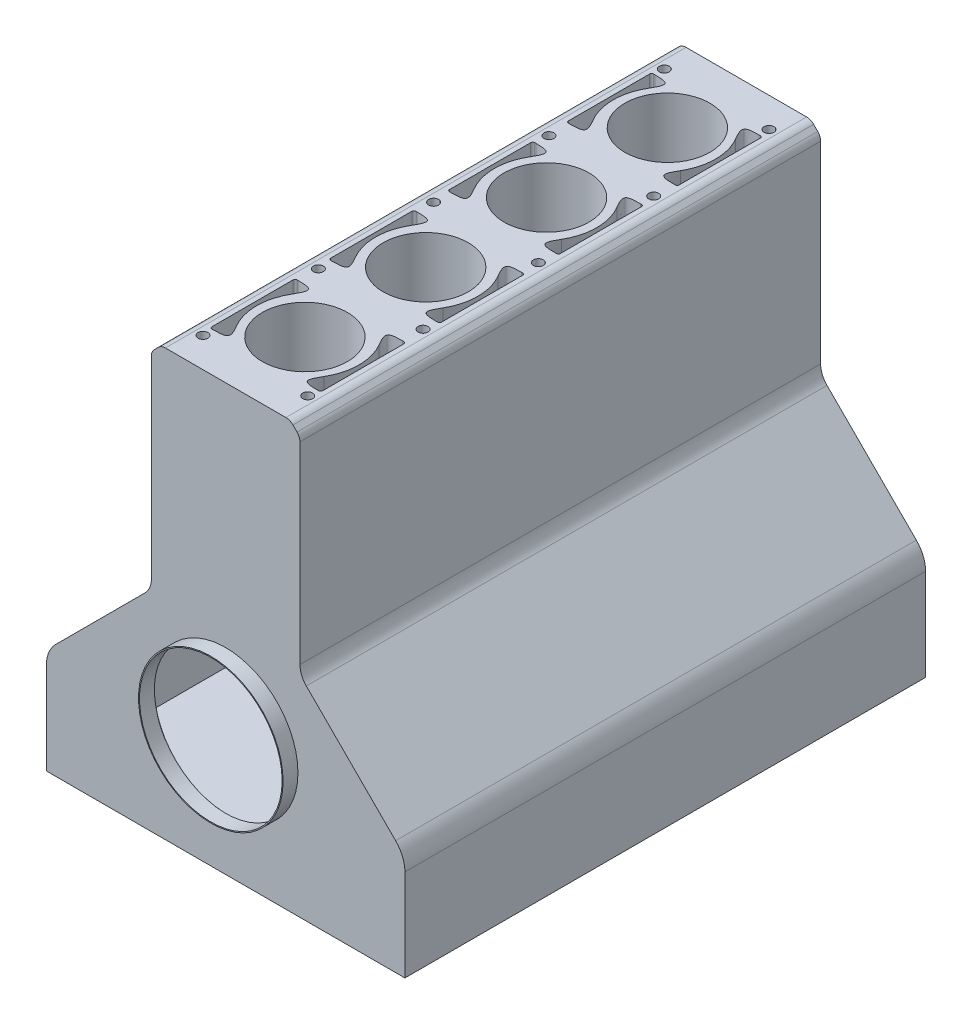
from build123d import *

# Parameters (mm, degrees)
Y_KSEKLIK_EKSTR_ZYON1_DEPTH = 262.875
IZIM2_R                     = 43
KES_EKSTR_ZYON1_DEPTH       = 527
KES_EKSTR_ZYON2_DEPTH       = 373.997675093
KES_EKSTR_ZYON2_DEPTH_BACK  = 373.997675093
IZIM3_R                     = 5
KES_EKSTR_ZYON3_DEPTH       = 373.997675093
RADYUS2_DEPTH               = 218
RADYUS3_R                   = 2
RADYUS4_R                   = 2
L_O_ALTMA1_COUNT            = 4
L_O_ALTMA1_PITCH            = 120
RADYUS3_OF_L_O_ALTMA1_R     = 2
RADYUS4_OF_L_O_ALTMA1_R     = 2
AYNALAMA1_START             = -1
AYNALAMA1_DEPTH             = 219
Y_KSEKLIK_EKSTR_ZYON3_DEPTH = 525.75
RADYUS5_R                   = 32
RADYUS6_R                   = 32
RADYUS7_R                   = 22
RADYUS8_R                   = 22
Y_KSEKLIK_EKSTR_ZYON4_DEPTH = 1
IZIM9_R                     = 73
KES_EKSTR_ZYON4_DEPTH       = 10
Y_KSEKLIK_EKSTR_ZYON5_START = 15
IZIM11_R                    = 73
IZIM11_R_2                  = 72
Y_KSEKLIK_EKSTR_ZYON5_DEPTH = 15
IZIM12_R                    = 36.5
KES_EKSTR_ZYON5_DEPTH       = 15


with BuildPart() as part:
    # Çizim1 → Yükseklik-Ekstrüzyon1 (new, symmetric)
    with BuildSketch(Plane.XY):
        with BuildLine():
            Line((-75, 218), (-135.857864376, 218))
            ThreePointArc((-135.857864376, 218), (-139.6846987, 217.238795325), (-142.928932188, 215.071067812))
            Line((-142.928932188, 215.071067812), (-147.071067812, 210.928932188))
            ThreePointArc((-147.071067812, 210.928932188), (-149.238795325, 207.6846987), (-150, 203.857864376))
            Line((-150, 203.857864376), (-150, 0))
            Line((-150, 0), (-93, 0))
            Line((-93, 0), (-57, 0))
            Line((-57, 0), (0, 0))
            Line((0, 0), (0, 203.857864376))
            ThreePointArc((0, 203.857864376), (-0.761204675, 207.6846987), (-2.928932188, 210.928932188))
            Line((-2.928932188, 210.928932188), (-7.071067812, 215.071067812))
            ThreePointArc((-7.071067812, 215.071067812), (-10.3153013, 217.238795325), (-14.142135624, 218))
            Line((-14.142135624, 218), (-75, 218))
        make_face()
    extrude(amount=Y_KSEKLIK_EKSTR_ZYON1_DEPTH, both=True)

    # Çizim2 → Kes-Ekstrüzyon1 (cut)
    with BuildSketch(Plane(origin=(0, 218, 0), x_dir=(1, 0, 0), z_dir=(0, 1, 0))):
        with Locations(Location((-74.997864376, 183.125, 0), (0, 0, 270))):
            Circle(IZIM2_R)
        with Locations(Location((-74.997864376, 61.125, 0), (0, 0, 270))):
            Circle(IZIM2_R)
        with Locations(Location((-74.997864376, -60.875, 0), (0, 0, 270))):
            Circle(IZIM2_R)
        with Locations(Location((-74.997864376, -182.875, 0), (0, 0, 270))):
            Circle(IZIM2_R)
    extrude(amount=-KES_EKSTR_ZYON1_DEPTH, mode=Mode.SUBTRACT)

    # Çizim3 → Kes-Ekstrüzyon2 (cut, two sides: drawn at the far end of the back side and taken through both)
    with BuildSketch(Plane(origin=(0, 218, 0), x_dir=(1, 0, 0), z_dir=(0, 1, 0)).offset(-KES_EKSTR_ZYON2_DEPTH_BACK)):
        with Locations(Location((-127.857864376, 232.875, 0), (0, 0, 180))):
            Circle(IZIM3_R)
        with Locations(Location((-127.857864376, 116.4375, 0), (0, 0, 180))):
            Circle(IZIM3_R)
        with Locations(Location((-127.857864376, 0, 0), (0, 0, 180))):
            Circle(IZIM3_R)
        with Locations(Location((-127.857864376, -116.4375, 0), (0, 0, 180))):
            Circle(IZIM3_R)
        with Locations(Location((-127.857864376, -232.875, 0), (0, 0, 180))):
            Circle(IZIM3_R)
        with Locations(Location((-22.142135624, -232.875, 0), (0, 0, 180))):
            Circle(IZIM3_R)
        with Locations(Location((-22.142135624, -116.4375, 0), (0, 0, 180))):
            Circle(IZIM3_R)
        with Locations(Location((-22.142135624, 0, 0), (0, 0, 180))):
            Circle(IZIM3_R)
        with Locations(Location((-22.142135624, 232.875, 0), (0, 0, 180))):
            Circle(IZIM3_R)
        with Locations(Location((-22.142135624, 116.4375, 0), (0, 0, 180))):
            Circle(IZIM3_R)
    extrude(amount=KES_EKSTR_ZYON2_DEPTH + KES_EKSTR_ZYON2_DEPTH_BACK, mode=Mode.SUBTRACT)

    # Çizim4 → Kes-Ekstrüzyon3 (cut, symmetric)
    with BuildSketch(Plane(origin=(0, 218, 0), x_dir=(1, 0, 0), z_dir=(0, 1, 0))):
        with BuildLine():
            Line((-105.952280541, -222.875), (-130.952280541, -222.875))
            Line((-130.952280541, -222.875), (-130.952280541, -136.875))
            Line((-130.952280541, -136.875), (-105.952280541, -136.875))
            ThreePointArc((-105.952280541, -136.875), (-126.756461716, -179.875), (-105.952280541, -222.875))
        make_face()
    kes_ekstr_zyon3 = extrude(amount=KES_EKSTR_ZYON3_DEPTH, both=True, mode=Mode.SUBTRACT)

    # Radyus1
    # a fillet whose section is not a circle: 10 mm, written as the material it adds along each edge
    with BuildSketch(Plane(origin=(-105.952280541, 0, 136.875), x_dir=(-0.6575759712071374, 0, 0.753388241274703), z_dir=(0, 1, 0))) as radyus1_piece_1:
        with BuildLine():
            Bezier((20.028756349, 0), (2.793971119, -3.201067374), (14.320973189, -16.407614141), weights=[1, 1.857142857, 1])
            Line((14.320973189, -16.407614141), (0, 0))
            ThreePointArc((0, 0), (10.014378174, -0.922114902), (20.028756349, 0))
        make_face()
    extrude(amount=218)

    # Radyus2: read off the stored shape, not the designer's step
    # Radyus2 outline → Radyus2 (add)
    with BuildSketch(Plane(origin=(0, 0, 0), x_dir=(1, 0, 0), z_dir=(0, 1, 0))):
        with BuildLine():
            ThreePointArc((-105.952280541, -222.875), (-113.232205519, -215.936645842), (-119.122709449, -207.78557048))
            add(Edge.make_bspline(
                [(-119.122709449, -207.78557048), (-110.201175332, -222.875), (-127.730711956, -222.875)],
                knots=[0, 0, 0, 1, 1, 1], degree=2, weights=[1, 1.857142857, 1]))
            Line((-127.730711956, -222.875), (-105.952280541, -222.875))
        make_face()
    radyus2 = extrude(amount=RADYUS2_DEPTH)

    # Radyus3
    radyus3_edges = [part.edges().sort_by_distance(p)[0] for p in [
        (-130.952280541, 109, 136.875),
    ]]
    fillet(radyus3_edges, radius=RADYUS3_R)

    # Radyus4
    radyus4_edges = [part.edges().sort_by_distance(p)[0] for p in [
        (-130.952280541, 109, 222.875),
    ]]
    fillet(radyus4_edges, radius=RADYUS4_R)

    # LÇoğaltma1: Kes-Ekstrüzyon3, Radyus2 ×4
    with Locations(*[(0, 0, -i * L_O_ALTMA1_PITCH) for i in range(1, L_O_ALTMA1_COUNT)]):
        add(kes_ekstr_zyon3, mode=Mode.SUBTRACT)
        add(radyus2)

    # Radyus1 of LÇoğaltma1
    # a fillet whose section is not a circle: 10 mm, written as the material it adds along each edge
    with BuildSketch(Plane(origin=(-105.952280541, 0, 16.875), x_dir=(-0.657575971207137, 0, 0.7533882412747033), z_dir=(0, 1, 0)), Plane(origin=(-105.952280541, 0, -103.125), x_dir=(-0.657575971207137, 0, 0.7533882412747033), z_dir=(0, 1, 0)), Plane(origin=(-105.952280541, 0, -223.125), x_dir=(-0.6575759712071367, 0, 0.7533882412747037), z_dir=(0, 1, 0))) as radyus1_of_l_o_altma1_piece_1:
        with BuildLine():
            Bezier((20.028756349, 0), (2.793971119, -3.201067374), (14.320973189, -16.407614141), weights=[1, 1.857142857, 1])
            Line((14.320973189, -16.407614141), (0, 0))
            ThreePointArc((0, 0), (10.014378174, -0.922114902), (20.028756349, 0))
        make_face()
    extrude(amount=218)

    # Radyus3 of LÇoğaltma1
    radyus3_of_l_o_altma1_edges = [part.edges().sort_by_distance(p)[0] for p in [
        (-130.952280541, 109, 16.875),
        (-130.952280541, 109, -103.125),
        (-130.952280541, 109, -223.125),
    ]]
    fillet(radyus3_of_l_o_altma1_edges, radius=RADYUS3_OF_L_O_ALTMA1_R)

    # Radyus4 of LÇoğaltma1
    radyus4_of_l_o_altma1_edges = [part.edges().sort_by_distance(p)[0] for p in [
        (-130.952280541, 109, 102.875),
        (-130.952280541, 109, -17.125),
        (-130.952280541, 109, -137.125),
    ]]
    fillet(radyus4_of_l_o_altma1_edges, radius=RADYUS4_OF_L_O_ALTMA1_R)

    # Aynalama1: read off the stored shape, not the designer's step
    # Aynalama1 outline → Aynalama1 (cut)
    with BuildSketch(Plane(origin=(0, 0, 0), x_dir=(1, 0, 0), z_dir=(0, 1, 0)).offset(AYNALAMA1_START)):
        with BuildLine():
            add(Edge.make_bspline(
                [(-22.269288044, 137.125), (-39.798824668, 137.125), (-30.877290551, 152.21442952)],
                knots=[0, 0, 0, 1, 1, 1], degree=2, weights=[1, 1.857142857, 1]))
            Line((-22.269288044, 137.125), (-21.047719459, 137.125))
            ThreePointArc((-21.047719459, 137.125), (-19.633505897, 137.710786438), (-19.047719459, 139.125))
            Line((-19.047719459, 139.125), (-19.047719459, 221.125))
            ThreePointArc((-19.047719459, 221.125), (-19.633505897, 222.539213562), (-21.047719459, 223.125))
            Line((-21.047719459, 223.125), (-22.269288044, 223.125))
            add(Edge.make_bspline(
                [(-30.877290551, 208.03557048), (-39.798824668, 223.125000002), (-22.269288044, 223.125)],
                knots=[0, 0, 0, 1, 1, 1], degree=2, weights=[1, 1.857142857, 1]))
            ThreePointArc((-30.877290551, 208.03557048), (-23.243538284, 180.125), (-30.877290551, 152.21442952))
        make_face()
        with BuildLine():
            add(Edge.make_bspline(
                [(-22.269288044, 17.125), (-39.798824669, 17.124999999), (-30.877290551, 32.21442952)],
                knots=[0, 0, 0, 1, 1, 1], degree=2, weights=[1, 1.857142857, 1]))
            Line((-22.269288044, 17.125), (-21.047719459, 17.125))
            ThreePointArc((-21.047719459, 17.125), (-19.633505897, 17.710786438), (-19.047719459, 19.125))
            Line((-19.047719459, 19.125), (-19.047719459, 101.125))
            ThreePointArc((-19.047719459, 101.125), (-19.633505897, 102.539213562), (-21.047719459, 103.125))
            Line((-21.047719459, 103.125), (-22.269288044, 103.125))
            add(Edge.make_bspline(
                [(-30.877290551, 88.03557048), (-39.798824668, 103.125000001), (-22.269288044, 103.125)],
                knots=[0, 0, 0, 1, 1, 1], degree=2, weights=[1, 1.857142857, 1]))
            ThreePointArc((-30.877290551, 88.03557048), (-23.243538284, 60.125), (-30.877290551, 32.21442952))
        make_face()
        with BuildLine():
            add(Edge.make_bspline(
                [(-22.269288044, -102.875), (-39.798824669, -102.875), (-30.877290551, -87.78557048)],
                knots=[0, 0, 0, 1, 1, 1], degree=2, weights=[1, 1.857142857, 1]))
            Line((-22.269288044, -102.875), (-21.047719459, -102.875))
            ThreePointArc((-21.047719459, -102.875), (-19.633505897, -102.289213562), (-19.047719459, -100.875))
            Line((-19.047719459, -100.875), (-19.047719459, -18.875))
            ThreePointArc((-19.047719459, -18.875), (-19.633505897, -17.460786438), (-21.047719459, -16.875))
            Line((-21.047719459, -16.875), (-22.269288044, -16.875))
            add(Edge.make_bspline(
                [(-30.877290551, -31.96442952), (-39.798824669, -16.874999999), (-22.269288044, -16.875)],
                knots=[0, 0, 0, 1, 1, 1], degree=2, weights=[1, 1.857142857, 1]))
            ThreePointArc((-30.877290551, -31.96442952), (-23.243538284, -59.875), (-30.877290551, -87.78557048))
        make_face()
        with BuildLine():
            add(Edge.make_bspline(
                [(-22.269288044, -222.875), (-39.798824668, -222.875), (-30.877290551, -207.78557048)],
                knots=[0, 0, 0, 1, 1, 1], degree=2, weights=[1, 1.857142857, 1]))
            Line((-22.269288044, -222.875), (-21.047719459, -222.875))
            ThreePointArc((-21.047719459, -222.875), (-19.633505897, -222.289213562), (-19.047719459, -220.875))
            Line((-19.047719459, -220.875), (-19.047719459, -138.875))
            ThreePointArc((-19.047719459, -138.875), (-19.633505897, -137.460786438), (-21.047719459, -136.875))
            Line((-21.047719459, -136.875), (-22.269288044, -136.875))
            add(Edge.make_bspline(
                [(-30.877290551, -151.96442952), (-39.798824668, -136.875), (-22.269288044, -136.875)],
                knots=[0, 0, 0, 1, 1, 1], degree=2, weights=[1, 1.857142857, 1]))
            ThreePointArc((-30.877290551, -151.96442952), (-23.243538284, -179.875), (-30.877290551, -207.78557048))
        make_face()
    extrude(amount=AYNALAMA1_DEPTH, mode=Mode.SUBTRACT)

    # Çizim7 → Yükseklik-Ekstrüzyon3 (add)
    with BuildSketch(Plane.XY.offset(262.875)):
        Polygon((-150, 0), (0, 0), (106, -106), (106, -212), (-256, -212), (-256, -106), align=None)
        Polygon((-147.928932188, -5), (-2.071067812, -5), (101, -108.071067812), (101, -207), (-251, -207), (-251, -108.071067812), align=None, mode=Mode.SUBTRACT)
    extrude(amount=-Y_KSEKLIK_EKSTR_ZYON3_DEPTH)

    # Radyus5
    radyus5_edges = [part.edges().sort_by_distance(p)[0] for p in [
        (106, -106, 0),
    ]]
    fillet(radyus5_edges, radius=RADYUS5_R)

    # Radyus6
    radyus6_edges = [part.edges().sort_by_distance(p)[0] for p in [
        (-256, -106, 0),
    ]]
    fillet(radyus6_edges, radius=RADYUS6_R)

    # Radyus7
    radyus7_edges = [part.edges().sort_by_distance(p)[0] for p in [
        (0, 0, 0),
    ]]
    fillet(radyus7_edges, radius=RADYUS7_R)

    # Radyus8
    radyus8_edges = [part.edges().sort_by_distance(p)[0] for p in [
        (-150, 0, 0),
    ]]
    fillet(radyus8_edges, radius=RADYUS8_R)

    # Çizim8 → Yükseklik-Ekstrüzyon4 (add)
    with BuildSketch(Plane.XY.offset(262.875)):
        with BuildLine():
            Line((-156.443650814, -6.443650814), (-246.627416998, -96.627416998))
            ThreePointArc((-246.627416998, -96.627416998), (-253.56414504, -107.00896416), (-256, -119.254833996))
            Line((-256, -119.254833996), (-256, -212))
            Line((-256, -212), (106, -212))
            Line((106, -212), (106, -119.254833996))
            ThreePointArc((106, -119.254833996), (103.56414504, -107.00896416), (96.627416998, -96.627416998))
            Line((96.627416998, -96.627416998), (6.443650814, -6.443650814))
            ThreePointArc((6.443650814, -6.443650814), (1.674650285, 0.69366286), (0, 9.112698372))
            Line((0, 9.112698372), (-150, 9.112698372))
            ThreePointArc((-150, 9.112698372), (-151.674650285, 0.69366286), (-156.443650814, -6.443650814))
        make_face()
    y_kseklik_ekstr_zyon4 = extrude(amount=-Y_KSEKLIK_EKSTR_ZYON4_DEPTH)

    # Aynalama2: Yükseklik-Ekstrüzyon4 across plane
    add(y_kseklik_ekstr_zyon4.mirror(Plane(origin=(0, 0, 0), x_dir=(1, 0, 0), z_dir=(0, 0, -1))))

    # Çizim9 → Kes-Ekstrüzyon4 (cut)
    with BuildSketch(Plane.XY.offset(262.875)):
        with Locations((-75, -86.55)):
            Circle(IZIM9_R)
    extrude(amount=-KES_EKSTR_ZYON4_DEPTH, mode=Mode.SUBTRACT)

    # Çizim12 → Kes-Ekstrüzyon5 (cut)
    with BuildSketch(Plane(origin=(0, 0, -262.875), x_dir=(-1, 0, 0), z_dir=(0, 0, -1))):
        with Locations((75, -86.55)):
            Circle(IZIM12_R)
    extrude(amount=-KES_EKSTR_ZYON5_DEPTH, mode=Mode.SUBTRACT)


with BuildPart() as body_2:
    # Çizim11 → Yükseklik-Ekstrüzyon5 (new body)
    with BuildSketch(Plane.XY.offset(262.875).offset(Y_KSEKLIK_EKSTR_ZYON5_START)):
        with Locations((-75, -86.55)):
            Circle(IZIM11_R)
        with Locations((-75, -86.55)):
            Circle(IZIM11_R_2, mode=Mode.SUBTRACT)
    extrude(amount=-Y_KSEKLIK_EKSTR_ZYON5_DEPTH)


solid = Compound([part.part, body_2.part])
